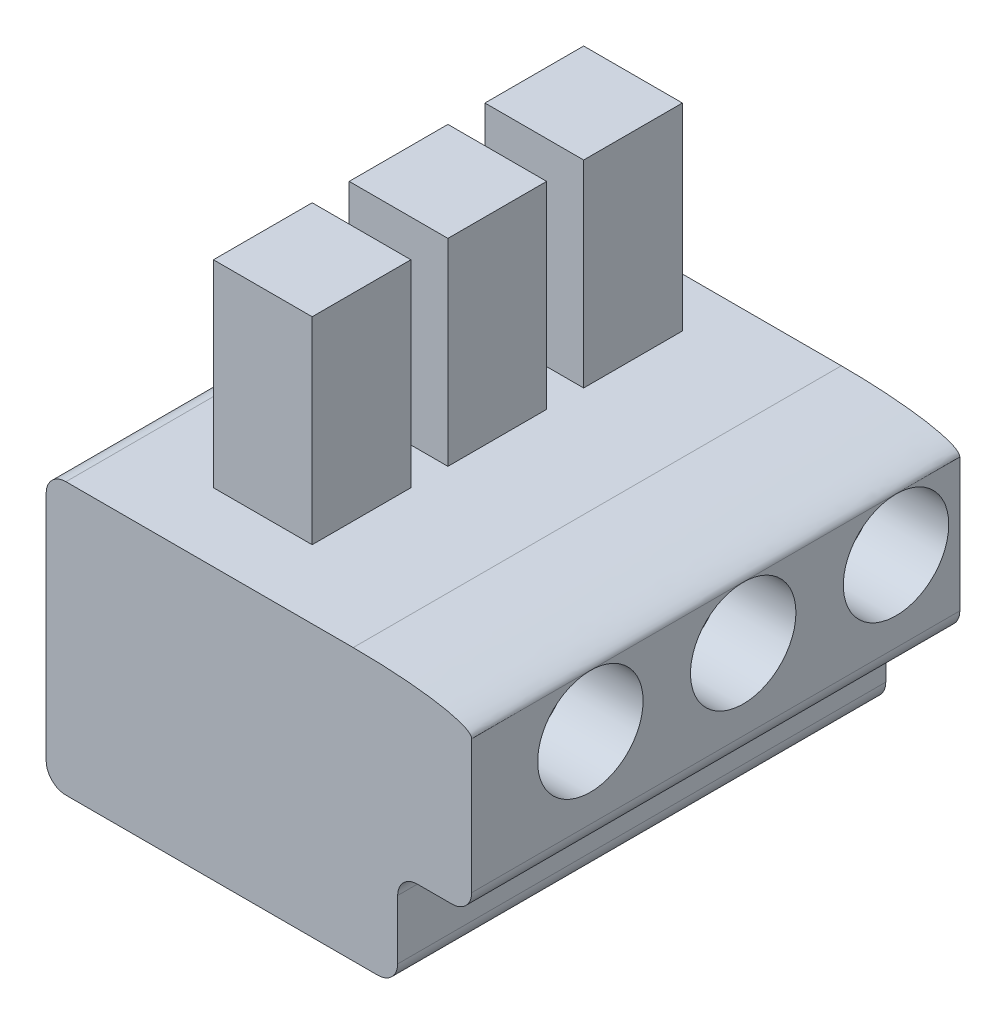
from build123d import *

# Parameters (mm, degrees)
SKETCH1_W           = 11.303
SKETCH1_H           = 15.6972
BOSS_EXTRUDE1_DEPTH = 8.73125
SKETCH2_W           = 15.6972
SKETCH2_H           = 5.55625
BOSS_EXTRUDE2_DEPTH = 2.38125
FILLET1_R           = 0.635
SKETCH5_R           = 1.69545
CUT_EXTRUDE1_DEPTH  = 2.38125
SKETCH7_W           = 3.175
SKETCH7_H           = 3.175
BOSS_EXTRUDE3_DEPTH = 6.35
FILLET2_SIZE        = 0.635
FILLET2_SIZE_2      = 3.81
FILLET3_R           = 0.635


with BuildPart() as part:
    # Sketch1 → Boss-Extrude1 (new body)
    with BuildSketch(Plane(origin=(0, 0, 0), x_dir=(1, 0, 0), z_dir=(0, 1, 0))):
        with Locations((5.6515, 7.8486)):
            Rectangle(SKETCH1_W, SKETCH1_H)
    extrude(amount=BOSS_EXTRUDE1_DEPTH)

    # Sketch2 → Boss-Extrude2 (add)
    with BuildSketch(Plane(origin=(11.303, 0, 0), x_dir=(0, 0, -1), z_dir=(1, 0, 0))):
        with Locations((7.8486, 5.953125)):
            Rectangle(SKETCH2_W, SKETCH2_H)
    extrude(amount=BOSS_EXTRUDE2_DEPTH)

    # Fillet1
    fillet1_edges = [part.edges().sort_by_distance(p)[0] for p in [
        (13.68425, 3.175, -7.8486),
    ]]
    fillet(fillet1_edges, radius=FILLET1_R)

    # Sketch5 → Cut-Extrude1 (cut)
    with BuildSketch(Plane(origin=(13.68425, 0, 0), x_dir=(0, 0, -1), z_dir=(1, 0, 0))):
        with Locations((13.64615, 6.39445)):
            Circle(SKETCH5_R)
        with Locations((8.73125, 6.39445)):
            Circle(SKETCH5_R)
        with Locations((3.81635, 6.39445)):
            Circle(SKETCH5_R)
    extrude(amount=-CUT_EXTRUDE1_DEPTH, mode=Mode.SUBTRACT)

    # Sketch7 → Boss-Extrude3 (add)
    with BuildSketch(Plane(origin=(0, 8.73125, 0), x_dir=(1, 0, 0), z_dir=(0, 1, 0))):
        with Locations((4.7625, 3.79095)):
            Rectangle(SKETCH7_W, SKETCH7_H)
        with Locations((4.7625, 12.5222)):
            Rectangle(SKETCH7_W, SKETCH7_H)
        with Locations((4.7625, 8.156575)):
            Rectangle(SKETCH7_W, SKETCH7_H)
    extrude(amount=BOSS_EXTRUDE3_DEPTH)

    # Fillet2
    # an asymmetric fillet: 3.81, 0.635 mm, written as the material it takes off along each edge
    with BuildSketch(Plane(origin=(13.68425, 8.73125, 9.525), x_dir=(0, -1, 0), z_dir=(0, 0, -1))) as fillet2_piece_1:
        with BuildLine():
            Bezier((FILLET2_SIZE, 0), (0, 0), (0, FILLET2_SIZE_2), weights=[1, 0.707106781, 1])
            Line((0, FILLET2_SIZE_2), (0, 0))
            Line((0, 0), (FILLET2_SIZE, 0))
        make_face()
    extrude(amount=34.7472, mode=Mode.SUBTRACT)

    # Fillet3
    fillet3_edges = [part.edges().sort_by_distance(p)[0] for p in [
        (11.303, 3.175, -7.8486),
        (11.303, 0, -7.8486),
        (0, 0, -7.8486),
        (0, 8.73125, -7.8486),
    ]]
    fillet(fillet3_edges, radius=FILLET3_R)


solid = part.part
